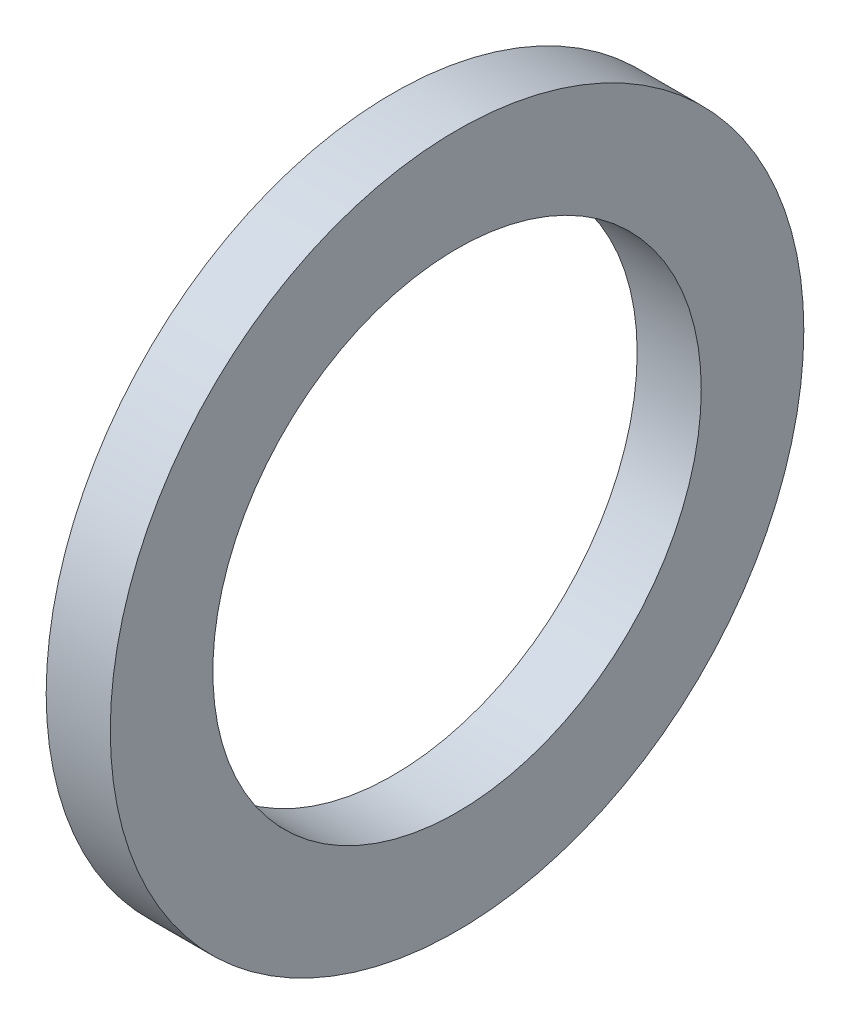
from build123d import *

# Parameters (mm, degrees)
SKETCH1_R           = 5.41
SKETCH1_R_2         = 3.81
BOSS_EXTRUDE1_DEPTH = 1.000000032


with BuildPart() as part:
    # Sketch1 → Boss-Extrude1 (new body)
    with BuildSketch(Plane(origin=(0, 0, 0), x_dir=(0, 0, -1), z_dir=(1, 0, 0))):
        Circle(SKETCH1_R)
        Circle(SKETCH1_R_2, mode=Mode.SUBTRACT)
    extrude(amount=BOSS_EXTRUDE1_DEPTH)


solid = part.part
